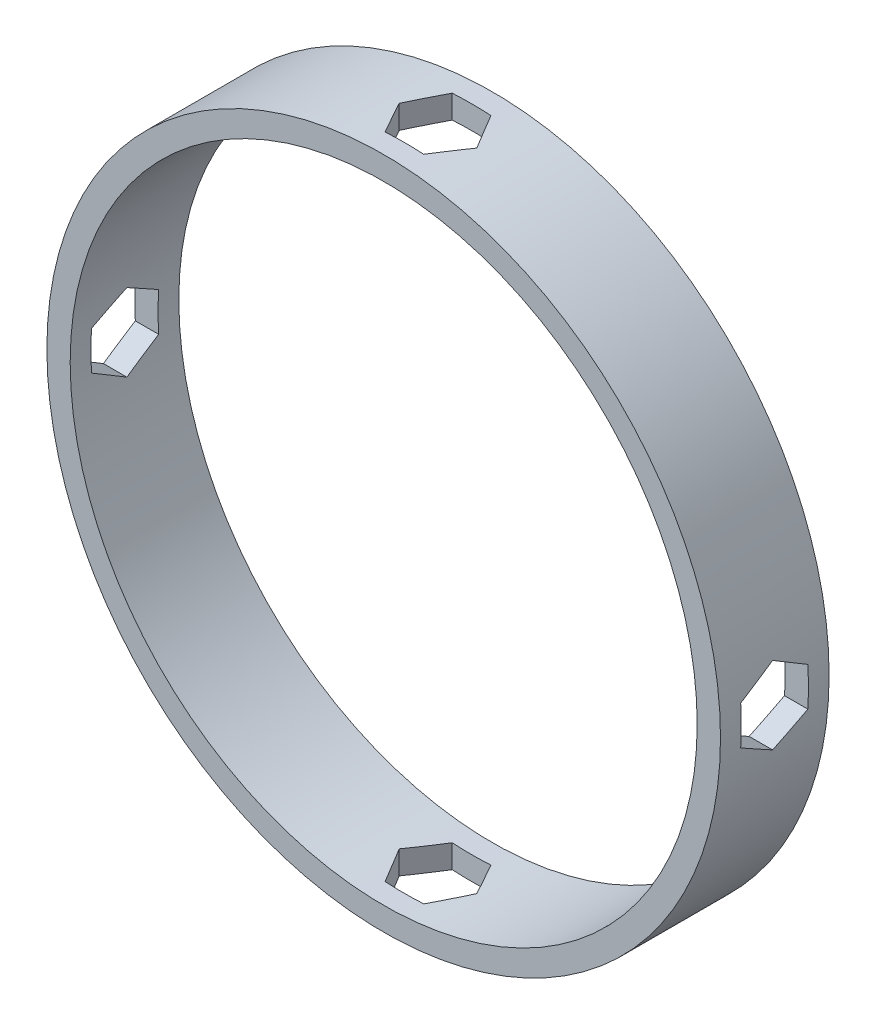
from build123d import *

# Parameters (mm, degrees)
BOSS_EXTRUDE1_DEPTH      = 10.5
BOSS_EXTRUDE1_DEPTH_BACK = 0.5
SKETCH1_R                = 34.11
SKETCH1_R_2              = 31.75
CUT_EXTRUDE1_DEPTH       = 77.991626168
CIRPATTERN2_COUNT        = 2
CIRPATTERN2_ANGLE        = 90


with BuildPart() as part:
    # Sketch1 → Boss-Extrude1 (new, two sides: drawn at the far end of the back side and taken through both)
    with BuildSketch(Plane.XY.offset(-BOSS_EXTRUDE1_DEPTH_BACK)):
        Circle(SKETCH1_R)
        Circle(SKETCH1_R_2, mode=Mode.SUBTRACT)
    extrude(amount=BOSS_EXTRUDE1_DEPTH + BOSS_EXTRUDE1_DEPTH_BACK)

    # Sketch2 → Cut-Extrude1 (cut, through all)
    with BuildSketch(Plane(origin=(0, 34.11, 0), x_dir=(1, 0, 0), z_dir=(0, 1, 0))):
        Polygon((3.92598183, -5), (1.962990915, -1.6), (-1.962990915, -1.6), (-3.92598183, -5), (-1.962990915, -8.4), (1.962990915, -8.4), align=None)
    cut_extrude1 = extrude(amount=-CUT_EXTRUDE1_DEPTH, mode=Mode.SUBTRACT)

    # CirPattern2: Cut-Extrude1 ×2 about axis
    cirpattern2_axis = Axis((0, 0, 10.5), (0, 0, 1))
    for i in range(1, CIRPATTERN2_COUNT):
        add(cut_extrude1.rotate(cirpattern2_axis, i * CIRPATTERN2_ANGLE / (CIRPATTERN2_COUNT - 1)), mode=Mode.SUBTRACT)


solid = part.part
